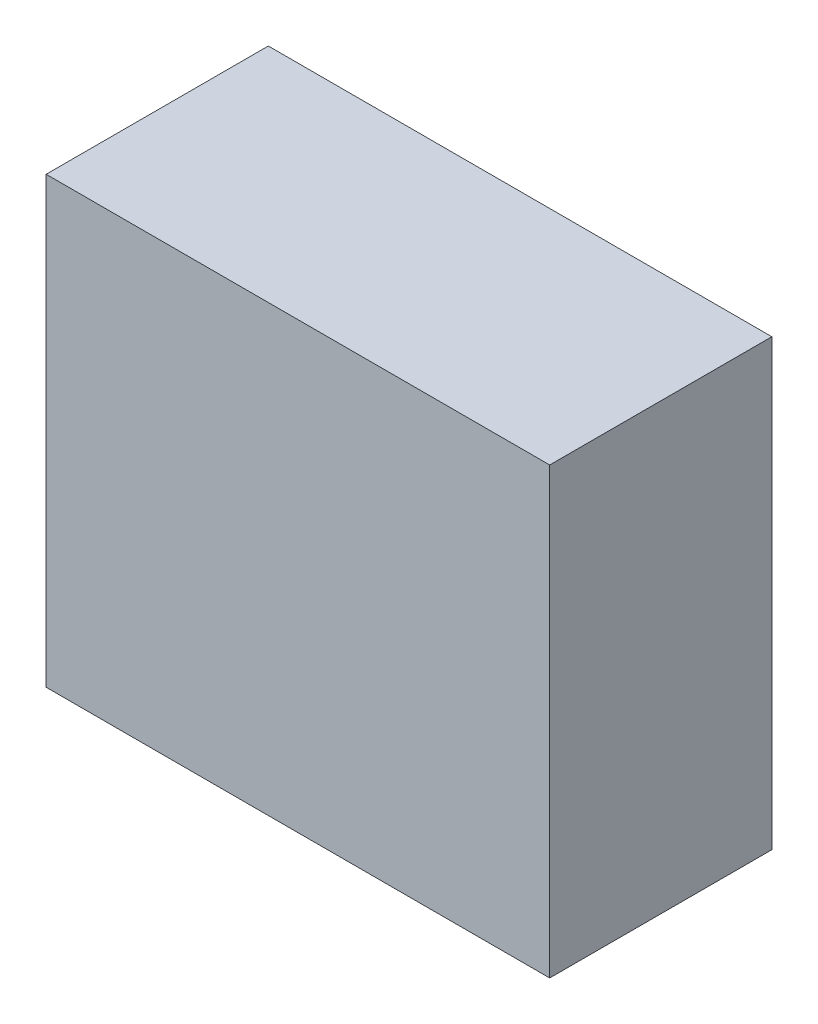
from build123d import *

# Parameters (mm, degrees)
SKETCH1_W           = 34
SKETCH1_H           = 30
BOSS_EXTRUDE1_DEPTH = 15
SKETCH2_R           = 2.1
CUT_EXTRUDE1_DEPTH  = 6
CHAMFER1_SIZE       = 1


with BuildPart() as part:
    # Sketch1 → Boss-Extrude1 (new body)
    with BuildSketch(Plane.XY):
        Rectangle(SKETCH1_W, SKETCH1_H)
    extrude(amount=BOSS_EXTRUDE1_DEPTH)

    # Sketch2 → Cut-Extrude1 (cut)
    with BuildSketch(Plane(origin=(0, 0, 0), x_dir=(-1, 0, 0), z_dir=(0, 0, -1))):
        with Locations((12, -9)):
            Circle(SKETCH2_R)
        with Locations((12, 9)):
            Circle(SKETCH2_R)
        with Locations((-12, 9)):
            Circle(SKETCH2_R)
        with Locations((-12, -9)):
            Circle(SKETCH2_R)
    extrude(amount=-CUT_EXTRUDE1_DEPTH, mode=Mode.SUBTRACT)

    # Chamfer1
    chamfer1_edges = [part.edges().sort_by_distance(p)[0] for p in [
        (14.1, -9, 0),
        (-9.9, -9, 0),
        (-9.9, 9, 0),
        (14.1, 9, 0),
    ]]
    chamfer(chamfer1_edges, length=CHAMFER1_SIZE)


solid = part.part
